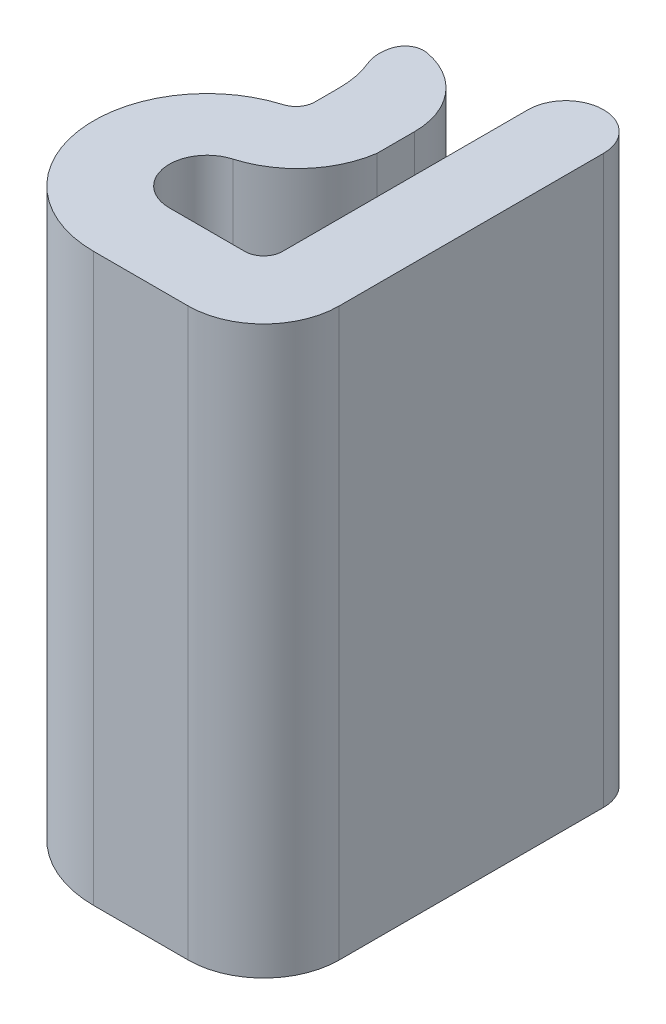
from build123d import *

# Parameters (mm, degrees)
BOSS_EXTRUDE1_DEPTH      = 7.5
BOSS_EXTRUDE1_DEPTH_BACK = 7.5
FILLET3_R                = 1
FILLET4_R                = 1
FILLET5_R                = 0.5


# Some blends are built 0.0001 mm under size
with BuildPart() as part:
    # Sketch1 → Boss-Extrude1 (new, two sides: drawn at the far end of the back side and taken through both)
    with BuildSketch(Plane.XZ.offset(-16.5).offset(-BOSS_EXTRUDE1_DEPTH_BACK)):
        with BuildLine():
            Line((32.25, 34.5), (32.25, 35.5))
            ThreePointArc((32.25, 35.5), (31.660669064, 36.78109942), (30.471806841, 37.539474849))
            ThreePointArc((30.471806841, 37.539474849), (29.759917895, 38.640489944), (30.75, 39.5))
            Line((30.75, 39.5), (32.75, 39.5))
            ThreePointArc((32.75, 39.5), (33.103553391, 39.353553391), (33.25, 39))
            Line((33.25, 39), (33.25, 31.5))
            Line((33.25, 31.5), (35.25, 31.5))
            Line((35.25, 31.5), (35.25, 39.5))
            ThreePointArc((35.25, 39.5), (34.664213562, 40.914213562), (33.25, 41.5))
            Line((33.25, 41.5), (30.75, 41.5))
            ThreePointArc((30.75, 41.5), (27.781428489, 38.933108746), (29.892857143, 35.625055458))
            ThreePointArc((29.892857143, 35.625055458), (30.150891863, 35.444705186), (30.25, 35.145898034))
            Line((30.25, 35.145898034), (30.25, 34.5))
            ThreePointArc((30.25, 34.5), (29.986067977, 33.381966011), (29.25, 32.5))
            Line((29.25, 32.5), (30.25, 32.5))
            ThreePointArc((30.25, 32.5), (31.664213562, 33.085786438), (32.25, 34.5))
        make_face()
    extrude(amount=BOSS_EXTRUDE1_DEPTH + BOSS_EXTRUDE1_DEPTH_BACK)

    # Fillet3
    # the kernel refuses this fillet: 1 mm, written as the material it takes off along each edge
    with BuildSketch(Plane(origin=(29.25, 5.673991819, 32.5), x_dir=(1, 0, 0), z_dir=(0, 1, 0))) as fillet3_piece_1:
        with BuildLine():
            CenterArc((1.738981007, -0.673726259), FILLET3_R, 137.644685186, 64.623066475)
            ThreePointArc((0.813557862, -1.052661613), (0.478087463, -0.471219443), (0, 0))
            Line((0, 0), (1, 0))
        make_face()
    extrude(amount=21.652016361, mode=Mode.SUBTRACT)

    # Fillet4
    fillet4_edges = [part.edges().sort_by_distance(p)[0] for p in [
        (35.25, 16.5, 31.5),
        (33.25, 16.5, 31.5),
    ]]
    fillet(fillet4_edges, radius=FILLET4_R - 0.0001)  # a hair under: the kernel refuses the full size

    # Fillet5
    fillet5_edges = [part.edges().sort_by_distance(p)[0] for p in [
        (30.25, 16.5, 32.5),
    ]]
    fillet(fillet5_edges, radius=FILLET5_R)


solid = part.part
